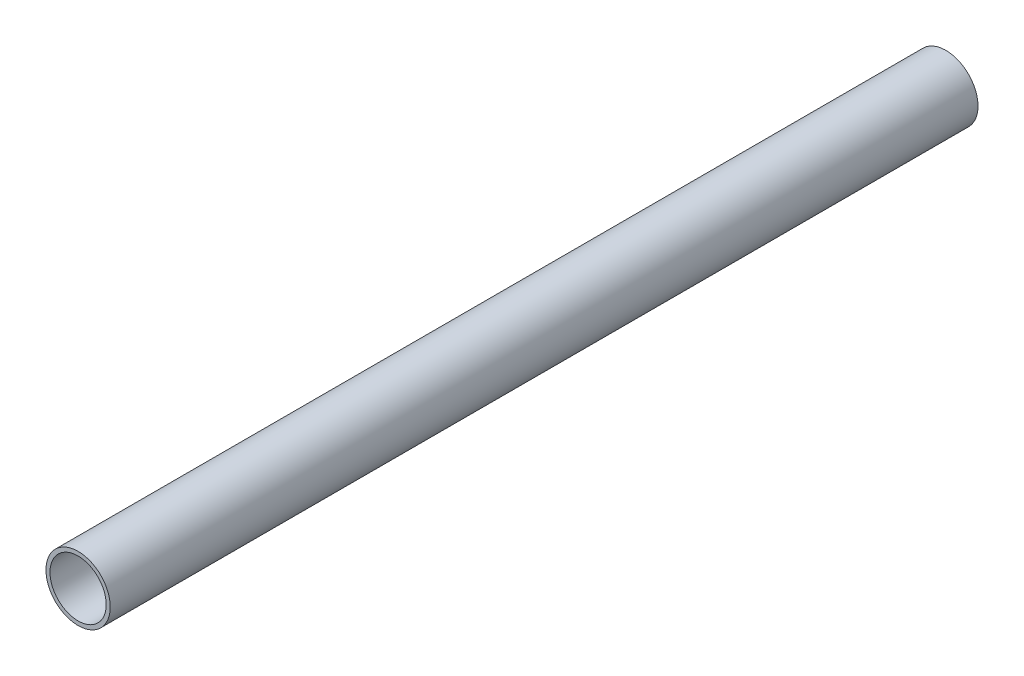
from build123d import *

# Parameters (mm, degrees)
SKETCH1_R           = 12.7
SKETCH1_R_2         = 11.1125
BOSS_EXTRUDE1_DEPTH = 342.74


with BuildPart() as part:
    # Sketch1 → Boss-Extrude1 (new body)
    with BuildSketch(Plane.XY):
        Circle(SKETCH1_R)
        Circle(SKETCH1_R_2, mode=Mode.SUBTRACT)
    extrude(amount=BOSS_EXTRUDE1_DEPTH)


solid = part.part
